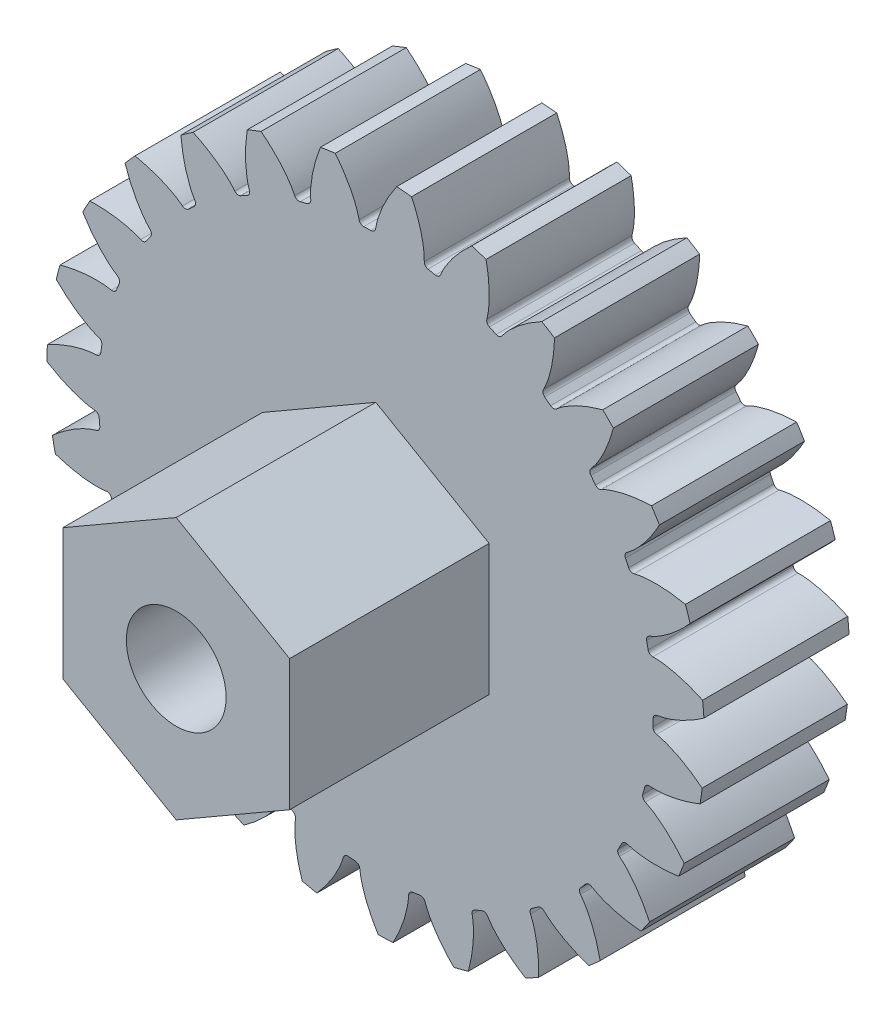
from build123d import *

# Parameters (mm, degrees)
SKETCH2_R                = 18.125
BOSS_EXTRUDE1_DEPTH      = 8
CUT_EXTRUDE1_DEPTH       = 8
FILLET1_R                = 0.254
CIRPATTERN3_COUNT        = 27
FILLET1_OF_CIRPATTERN3_R = 0.254
BOSS_EXTRUDE3_DEPTH      = 11
SKETCH6_R                = 2.75
CUT_EXTRUDE2_DEPTH       = 32.906176782


# Read off the part's stored shape, not the designer's step: Cut-Extrude1
with BuildPart() as part:
    # Sketch2 → Boss-Extrude1 (new body)
    with BuildSketch(Plane.XY):
        Circle(SKETCH2_R)
    extrude(amount=BOSS_EXTRUDE1_DEPTH)

    # Cut-Extrude1 outline → Cut-Extrude1 (cut)
    with BuildSketch(Plane.XY):
        with BuildLine():
            add(Edge.make_bspline(
                [(15.293943906, 0), (15.305253299, 0), (15.336964339, 0.00074082), (15.396845119, 0.005066139), (15.494240284, 0.016267993), (15.617714722, 0.036610689), (15.776289364, 0.069834677), (15.961506744, 0.117828662), (16.163035486, 0.179773153), (16.379749283, 0.256988095), (16.59342961, 0.342624014), (16.803983292, 0.435958219), (17.011216032, 0.536009953), (17.259008351, 0.665439426), (17.551466226, 0.832023435), (17.793413557, 0.984652677), (17.98203981, 1.112094263), (18.081230118, 1.181579697), (18.086216109, 1.185078834)],
                knots=[0, 0, 0, 0, 0, 0.005376748, 0.015083688, 0.02853182, 0.046610139, 0.064854849, 0.092110525, 0.119476175, 0.146842495, 0.174208853, 0.201574955, 0.228941013, 0.256307345, 0.307035032, 0.361767351, 0.364665932, 0.364665932, 0.364665932, 0.364665932, 0.364665932], degree=4))
            Line((15.293943906, 0), (15.269621682, -0.86219134))
            add(Edge.make_bspline(
                [(17.990644834, -2.202799001), (17.985864036, -2.199024345), (17.890748691, -2.124057592), (17.709606894, -1.986184932), (17.476648761, -1.820158714), (17.194047109, -1.637352405), (16.953945405, -1.49415955), (16.752682616, -1.382584249), (16.547725468, -1.277528577), (16.339212659, -1.179982683), (16.127196474, -1.090673365), (15.929480328, -1.017466265), (15.747263149, -0.959107033), (15.590813683, -0.916996286), (15.468682422, -0.889725108), (15.372073647, -0.873050446), (15.312531935, -0.865356246), (15.280913089, -0.862828904), (15.269621682, -0.86219134)],
                knots=[0.544424984, 0.544424984, 0.544424984, 0.544424984, 0.544424984, 0.547323565, 0.602055884, 0.652783571, 0.680149903, 0.707515961, 0.734882063, 0.762248421, 0.789614741, 0.816980391, 0.844236067, 0.862480777, 0.880559096, 0.894007228, 0.903714168, 0.909090916, 0.909090916, 0.909090916, 0.909090916, 0.909090916], degree=4))
            ThreePointArc((17.990644834, -2.202799001), (18.117792441, -0.511098867), (18.086216109, 1.185078834))
        make_face()
    cut_extrude1 = extrude(amount=CUT_EXTRUDE1_DEPTH, mode=Mode.SUBTRACT)

    # Fillet1
    fillet1_edges = [part.edges().sort_by_distance(p)[0] for p in [
        (15.269621682, -0.86219134, 4),
        (15.293943906, 0, 4),
    ]]
    fillet(fillet1_edges, radius=FILLET1_R)

    # CirPattern3: Cut-Extrude1 ×27 about axis
    cirpattern3_axis = Axis((0, 0, 18.908609159), (0, 0, -1))
    for i in range(1, CIRPATTERN3_COUNT):
        add(cut_extrude1.rotate(cirpattern3_axis, i * 360 / CIRPATTERN3_COUNT), mode=Mode.SUBTRACT)

    # Fillet1 of CirPattern3
    fillet1_of_cirpattern3_edges = [part.edges().sort_by_distance(p)[0] for p in [
        (14.659192047, -4.360367961, 4),
        (14.881693669, -3.527026191, 4),
        (13.258481574, -7.623476016, 4),
        (13.667167474, -6.863909487, 4),
        (11.143002927, -10.475600507, 4),
        (11.715840743, -9.830757646, 4),
        (8.426802109, -12.762982662, 4),
        (9.132910004, -12.267627116, 4),
        (5.256310208, -14.362309119, 4),
        (6.057621724, -14.043145632, 4),
        (1.802449263, -15.187359773, 4),
        (2.655765489, -15.061594533, 4),
        (-1.748582189, -15.193655931, 4),
        (-0.889263752, -15.268068974, 4),
        (-5.205347122, -14.380858165, 4),
        (-4.386352553, -14.651437864, 4),
        (-8.381490444, -12.792784613, 4),
        (-7.646971953, -13.244943947, 4),
        (-11.105785447, -10.515048731, 4),
        (-10.495341116, -11.124411673, 4),
        (-13.231364682, -7.67044385, 4),
        (-12.777903722, -8.404159486, 4),
        (-14.643637622, -4.412323356, 4),
        (-14.371606231, -5.230836887, 4),
        (-15.266468268, -0.916333368, 4),
        (-15.190531729, -1.775518517, 4),
        (-15.066279658, 2.629056389, 4),
        (-15.190531729, 1.775518517, 4),
        (-14.053864011, 6.032713036, 4),
        (-14.371606231, 5.230836887, 4),
        (-12.283800918, 9.111144562, 4),
        (-12.777903722, 8.404159486, 4),
        (-9.851514938, 11.698391926, 4),
        (-10.495341116, 11.124411673, 4),
        (-6.888131238, 13.654975953, 4),
        (-7.646971953, 13.244943947, 4),
        (-3.553406599, 14.875416692, 4),
        (-4.386352553, 14.651437864, 4),
        (-0.027116892, 15.293919867, 4),
        (-0.889263752, 15.268068974, 4),
        (3.500634695, 14.887923863, 4),
        (2.655765489, 15.061594533, 4),
        (6.839666159, 13.67931603, 4),
        (6.057621724, 14.043145632, 4),
        (9.80996945, 11.733252729, 4),
        (9.132910004, 12.267627116, 4),
        (12.251414749, 9.154646737, 4),
        (11.715840743, 9.830757646, 4),
        (14.032383107, 6.082511369, 4),
        (13.667167474, 6.863909487, 4),
        (15.05686206, 2.682466239, 4),
        (14.881693669, 3.527026191, 4),
    ]]
    fillet(fillet1_of_cirpattern3_edges, radius=FILLET1_OF_CIRPATTERN3_R)

    # Sketch5 → Boss-Extrude3 (add)
    with BuildSketch(Plane.XY.offset(8)):
        Polygon((0, -7.216878365), (6.25, -3.608439182), (6.25, 3.608439182), (0, 7.216878365), (-6.25, 3.608439182), (-6.25, -3.608439182), align=None)
    extrude(amount=BOSS_EXTRUDE3_DEPTH)

    # Sketch6 → Cut-Extrude2 (cut, through all)
    with BuildSketch(Plane.XY.offset(19)):
        Circle(SKETCH6_R)
    extrude(amount=-CUT_EXTRUDE2_DEPTH, mode=Mode.SUBTRACT)


solid = part.part
